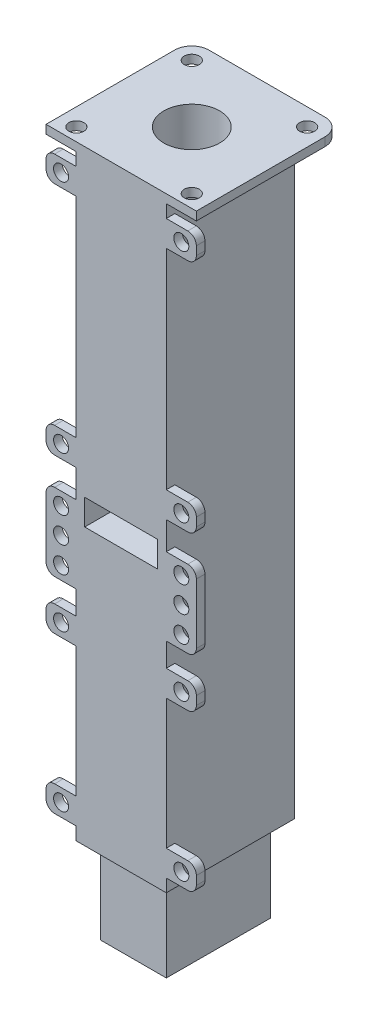
from build123d import *

# Parameters (mm, degrees)
ESQUISSE1_W                   = 35
ESQUISSE1_H                   = 35
BOSS_EXTRU_1_DEPTH            = 2
ESQUISSE2_R                   = 1.75
ESQUISSE2_W                   = 35
ESQUISSE2_H                   = 1.064971157
ENL_V_MAT_EXTRU_1_DEPTH       = 2
BOSS_EXTRU_2_DEPTH            = 280
ESQUISSE5_W                   = 7
ESQUISSE5_H                   = 6
ESQUISSE5_R                   = 1.75
BOSS_EXTRU_3_DEPTH            = 2
ESQUISSE6_R                   = 1.75
BOSS_EXTRU_4_DEPTH            = 2
ESQUISSE10_W                  = 35
ESQUISSE10_H                  = 33.935028843
ESQUISSE10_R                  = 1.75
BOSS_EXTRU_5_DEPTH            = 2
ESQUISSE15_R                  = 6.5
ESQUISSE15_R_2                = 1.75
ENL_V_MAT_EXTRU_2_DEPTH       = 373
CONG_1_R                      = 2
CONG_2_R                      = 4
EXTRU_MINCE1_START            = -2
EXTRU_MINCE1_OUTLINE_W        = 35
EXTRU_MINCE1_OUTLINE_H        = 10
EXTRU_MINCE1_DEPTH            = 2
BOSS_EXTRU_7_DEPTH            = 62.5
BOSS_EXTRU_8_DEPTH            = 160
ENL_V_MAT_EXTRU_4_DEPTH       = 15
BOSS_EXTRU_31_DEPTH           = 69.5
BOSS_EXTRU_31_DEPTH_BACK      = 90.5
ESQUISSE29_W                  = 0.210775501
ESQUISSE29_H                  = 2
BOSS_EXTRU_32_DEPTH           = 160
ENL_V_MAT_EXTRU_7_DEPTH       = 10
ENL_V_MAT_EXTRU_7_DEPTH_BACK  = 5
ESQUISSE34_W                  = 144
ESQUISSE34_H                  = 64.710678118
ENL_V_MAT_EXTRU_8_DEPTH       = 2
ESQUISSE35_R                  = 1.5
BOSS_EXTRU_35_DEPTH           = 2
BOSS_EXTRU_36_START           = -2
ESQUISSE36_R                  = 1.5
BOSS_EXTRU_36_DEPTH           = 2
BOSS_EXTRU_37_DEPTH           = 21
BOSS_EXTRU_38_DEPTH           = 28
ESQUISSE42_W                  = 17
ESQUISSE42_H                  = 6
ENL_V_MAT_EXTRU_9_DEPTH       = 124
ESQUISSE43_R                  = 1.1
ENL_V_MAT_EXTRU_11_DEPTH      = 50
ESQUISSE45_R                  = 1.5
ENL_V_MAT_EXTRU_12_DEPTH      = 50
ESQUISSE47_R                  = 1.75
BOSS_EXTRU_40_DEPTH           = 2
ENL_V_MAT_EXTRU_13_DEPTH      = 2
ESQUISSE49_R                  = 1.75
BOSS_EXTRU_41_DEPTH           = 2
ESQUISSE50_W                  = 12.927363302
ESQUISSE50_H                  = 18
ENL_V_MAT_EXTRU_14_DEPTH      = 2
ESQUISSE51_R                  = 1.75
BOSS_EXTRU_42_DEPTH           = 2
BOSS_EXTRU_43_DEPTH           = 2
BOSS_EXTRU_43_DEPTH_BACK      = 2
ESQUISSE53_R                  = 1.75
ENL_V_START                   = -2
ESQUISSE54_R                  = 1.75
ENL_V_MAT_EXTRU_15_DEPTH      = 2
BOSS_EXTRU_44_DEPTH           = 2
BOSS_EXTRU_44_DEPTH_BACK      = 2
ESQUISSE55_R                  = 1.75
ENL_V_MAT_EXTRU_16_DEPTH      = 131
ESQUISSE57_R                  = 6.500000627
BOSS_EXTRU_45_DEPTH           = 20
ENL_V_MAT_EXTRU_17_DEPTH      = 171
ENL_V_MAT_EXTRU_17_DEPTH_BACK = 20


# Read off the part's stored shape, not the designer's step: Extru.-Mince1
with BuildPart() as part:
    # Esquisse1 → Boss.-Extru.1 (new body)
    with BuildSketch(Plane(origin=(0, 0, 0), x_dir=(1, 0, 0), z_dir=(0, 1, 0))):
        with Locations((17.5, -17.5)):
            Rectangle(ESQUISSE1_W, ESQUISSE1_H)
    extrude(amount=BOSS_EXTRU_1_DEPTH)

    # Esquisse2 → Enlèv. mat.-Extru.1 (cut)
    with BuildSketch(Plane(origin=(0, 2, 0), x_dir=(1, 0, 0), z_dir=(0, 1, 0))):
        with Locations(Location((30.935029054, -4.064971369, 0), (0, 0, 270))):
            Circle(ESQUISSE2_R)
        with Locations(Location((30.935028843, -30.935028843, 0), (0, 0, 270))):
            Circle(ESQUISSE2_R)
        with Locations(Location((4.064971369, -4.064970946, 0), (0, 0, 270))):
            Circle(ESQUISSE2_R)
        with Locations(Location((4.064971157, -30.935028843, 0), (0, 0, 270))):
            Circle(ESQUISSE2_R)
        with Locations((17.5, -34.467514421)):
            Rectangle(ESQUISSE2_W, ESQUISSE2_H)
    extrude(amount=-ENL_V_MAT_EXTRU_1_DEPTH, mode=Mode.SUBTRACT)

    # Esquisse4 → Boss.-Extru.2 (add)
    with BuildSketch(Plane(origin=(0, 2, 0), x_dir=(1, 0, 0), z_dir=(0, 1, 0))):
        Polygon((17.5, -33.935028843), (7, -33.935028843), (7, -4.064970946), (28, -4.064970946), (28, -33.935028843), align=None)
    extrude(amount=BOSS_EXTRU_2_DEPTH)

    # Esquisse5 → Boss.-Extru.3 (add)
    # profile 1 of 4: a face of its own
    with BuildSketch(Plane.XY.offset(33.935028843)):
        with Locations((31.5, 254)):
            Rectangle(ESQUISSE5_W, ESQUISSE5_H)
        with Locations((31.5, 254)):
            Circle(ESQUISSE5_R, mode=Mode.SUBTRACT)
    # profile 2 of 4: a face of its own
    with BuildSketch(Plane.XY.offset(33.935028843)):
        with Locations((3.5, 254)):
            Rectangle(ESQUISSE5_W, ESQUISSE5_H)
        with Locations((3.5, 254)):
            Circle(ESQUISSE5_R, mode=Mode.SUBTRACT)
    # profile 3 of 4: a face of its own
    with BuildSketch(Plane.XY.offset(33.935028843)):
        with Locations((31.5, 28)):
            Rectangle(ESQUISSE5_W, ESQUISSE5_H)
        with Locations((31.5, 28)):
            Circle(ESQUISSE5_R, mode=Mode.SUBTRACT)
    # profile 4 of 4: a face of its own
    with BuildSketch(Plane.XY.offset(33.935028843)):
        with Locations((3.5, 28)):
            Rectangle(ESQUISSE5_W, ESQUISSE5_H)
        with Locations((3.5, 28)):
            Circle(ESQUISSE5_R, mode=Mode.SUBTRACT)
    extrude(amount=-BOSS_EXTRU_3_DEPTH)

    # Esquisse6 → Boss.-Extru.4 (add)
    # profile 1 of 2: a face of its own
    with BuildSketch(Plane.XY.offset(33.935028843)):
        Polygon((7, 144), (0, 144), (0, 141), (0, 138), (7, 138), (7, 141), align=None)
        with Locations((3.5, 141)):
            Circle(ESQUISSE6_R, mode=Mode.SUBTRACT)
    # profile 2 of 2: a face of its own
    with BuildSketch(Plane.XY.offset(33.935028843)):
        Polygon((35, 144), (28, 144), (28, 141), (28, 138), (35, 138), (35, 141), align=None)
        with Locations((31.5, 141)):
            Circle(ESQUISSE6_R, mode=Mode.SUBTRACT)
    extrude(amount=-BOSS_EXTRU_4_DEPTH)

    # Esquisse10 → Boss.-Extru.5 (add)
    with BuildSketch(Plane(origin=(0, 282, 0), x_dir=(1, 0, 0), z_dir=(0, 1, 0))):
        with Locations((17.5, -16.967514422)):
            Rectangle(ESQUISSE10_W, ESQUISSE10_H)
        with Locations(Location((30.935028843, -30.935028843, 0), (0, 0, 270))):
            Circle(ESQUISSE10_R, mode=Mode.SUBTRACT)
        with Locations(Location((30.935028631, -4.064970946, 0), (0, 0, 270.000013863))):
            Circle(ESQUISSE10_R, mode=Mode.SUBTRACT)
        with Locations(Location((4.064970946, -4.064971369, 0), (0, 0, 270.000013863))):
            Circle(ESQUISSE10_R, mode=Mode.SUBTRACT)
        with Locations(Location((4.064971157, -30.935028843, 0), (0, 0, 270))):
            Circle(ESQUISSE10_R, mode=Mode.SUBTRACT)
    extrude(amount=-BOSS_EXTRU_5_DEPTH)

    # Esquisse15 → Enlèv. mat.-Extru.2 (cut)
    with BuildSketch(Plane(origin=(0, 282, 0), x_dir=(1, 0, 0), z_dir=(0, 1, 0))):
        with Locations(Location((17.5, -17.5, 0), (0, 0, 270))):
            Circle(ESQUISSE15_R)
        with Locations(Location((30.935029054, -4.064971369, 0), (0, 0, 270))):
            Circle(ESQUISSE15_R_2)
    extrude(amount=-ENL_V_MAT_EXTRU_2_DEPTH, mode=Mode.SUBTRACT)

    # Congé1
    cong_1_edges = [part.edges().sort_by_distance(p)[0] for p in [
        (0, 31, 32.935028843),
        (0, 25, 32.935028843),
        (0, 144, 32.935028843),
        (0, 138, 32.935028843),
        (35, 144, 32.935028843),
        (35, 138, 32.935028843),
        (35, 257, 32.935028843),
        (35, 251, 32.935028843),
        (0, 251, 32.935028843),
        (0, 257, 32.935028843),
        (35, 31, 32.935028843),
        (35, 25, 32.935028843),
    ]]
    fillet(cong_1_edges, radius=CONG_1_R)

    # Congé2
    cong_2_edges = [part.edges().sort_by_distance(p)[0] for p in [
        (35, 281, 0),
        (0, 281, 0),
        (0, 1, 0),
        (35, 1, 0),
    ]]
    fillet(cong_2_edges, radius=CONG_2_R)

    # Extru.-Mince1 outline → Extru.-Mince1 (add)
    with BuildSketch(Plane(origin=(0, 282, 0), x_dir=(1, 0, 0), z_dir=(0, 1, 0)).offset(EXTRU_MINCE1_START)):
        with Locations((17.5, -38.935028843)):
            Rectangle(EXTRU_MINCE1_OUTLINE_W, EXTRU_MINCE1_OUTLINE_H)
    extrude(amount=EXTRU_MINCE1_DEPTH)

    # Esquisse20 → Boss.-Extru.7 (add)
    with BuildSketch(Plane.ZY):
        Polygon((43.935028843, 282), (114.645706961, 211.289321881), (110.645706961, 211.289321881), (41.935028843, 280), (34.145804344, 280), (34.145804344, 282), align=None)
    extrude(amount=BOSS_EXTRU_7_DEPTH)

    # Esquisse21 → Boss.-Extru.8 (add)
    with BuildSketch(Plane.ZY.offset(62.5)):
        Polygon((34.145804344, 280), (41.935028843, 280), (110.645706961, 211.289321881), (114.645706961, 211.289321881), (43.935028843, 282), (34.145804344, 282), align=None)
    extrude(amount=-BOSS_EXTRU_8_DEPTH)

    # Esquisse22 → Enlèv. mat.-Extru.4 (cut)
    with BuildSketch(Plane(origin=(0, 162.967514421, 162.967514421), x_dir=(1, 0, 0), z_dir=(0, 0.7071067811865462, 0.7071067811865488))):
        Polygon((-42.064466094, 147.626821562), (-45.6, 147.626821562), (-45.6, 89.047889374), (-42.064466094, 89.047889374), (-42.064466094, 85.512355468), (77.064466094, 85.512355468), (77.064466094, 89.047889374), (80.6, 89.047889374), (80.6, 147.626821562), (77.064466094, 147.626821562), (77.064466094, 151.162355468), (-42.064466094, 151.162355468), align=None)
    extrude(amount=-ENL_V_MAT_EXTRU_4_DEPTH, mode=Mode.SUBTRACT)

    # Esquisse29 → Boss.-Extru.31 (add, two sides: drawn at the far end of the back side and taken through both)
    with BuildSketch(Plane.ZY.offset(-7).offset(-BOSS_EXTRU_31_DEPTH_BACK)):
        with Locations((34.040416594, 281)):
            Rectangle(ESQUISSE29_W, ESQUISSE29_H)
    extrude(amount=BOSS_EXTRU_31_DEPTH + BOSS_EXTRU_31_DEPTH_BACK)

    # Esquisse32 → Boss.-Extru.32 (add)
    with BuildSketch(Plane.ZY.offset(62.5)):
        Polygon((110.645706961, 211.289321881), (33.935028843, 211.289321881), (33.935028843, 280), (35.935028843, 280), (35.935028843, 213.289321881), (108.645706961, 213.289321881), align=None)
    extrude(amount=-BOSS_EXTRU_32_DEPTH)

    # Esquisse33 → Enlèv. mat.-Extru.7 (cut, two sides: drawn at the far end of the back side and taken through both)
    with BuildSketch(Plane(origin=(0, 0, 33.935028843), x_dir=(-1, 0, 0), z_dir=(0, 0, -1)).offset(-ENL_V_MAT_EXTRU_7_DEPTH_BACK)):
        Polygon((-28, 274.000000001), (-89.5, 274.000000001), (-89.5, 219.289321881), (-81.5, 219.289321881), (-28, 219.289321881), align=None)
        with BuildLine():
            Line((54.5, 274.000000001), (-7, 274.000000001))
            Line((-7, 274.000000001), (-7, 257))
            Line((-7, 257), (-2, 257))
            ThreePointArc((-2, 257), (-0.585786438, 256.414213562), (0, 255))
            Line((0, 255), (0, 253))
            ThreePointArc((0, 253), (-0.585786438, 251.585786438), (-2, 251))
            Line((-2, 251), (-7, 251))
            Line((-7, 251), (-7, 219.289321881))
            Line((-7, 219.289321881), (1, 219.289321881))
            Line((1, 219.289321881), (54.5, 219.289321881))
            Line((54.5, 219.289321881), (54.5, 274.000000001))
        make_face()
        with BuildLine():
            Line((-2, 257), (-7, 257))
            Line((-7, 257), (-7, 251))
            Line((-7, 251), (-2, 251))
            ThreePointArc((-2, 251), (-0.585786438, 251.585786438), (0, 253))
            Line((0, 253), (0, 255))
            ThreePointArc((0, 255), (-0.585786438, 256.414213562), (-2, 257))
        make_face()
    extrude(amount=ENL_V_MAT_EXTRU_7_DEPTH + ENL_V_MAT_EXTRU_7_DEPTH_BACK, mode=Mode.SUBTRACT)

    # Esquisse34 → Enlèv. mat.-Extru.8 (cut)
    with BuildSketch(Plane.XZ.offset(-211.289321881)):
        with Locations((17.5, 74.290367902)):
            Rectangle(ESQUISSE34_W, ESQUISSE34_H)
    extrude(amount=-ENL_V_MAT_EXTRU_8_DEPTH, mode=Mode.SUBTRACT)

    # Esquisse35 → Boss.-Extru.35 (add)
    with BuildSketch(Plane(origin=(97.5, 0, 0), x_dir=(0, 0, -1), z_dir=(1, 0, 0))):
        Polygon((-35.935028843, 280), (-35.935028843, 274.000000001), (-35.935028843, 213.289321881), (-108.645706961, 213.289321881), (-102.645706961, 219.289321881), (-41.935028842, 219.289321881), (-41.935028842, 274.000000001), (-47.935028841, 274.000000001), (-41.935028843, 280), align=None)
        with Locations((-38.935028842, 216.289321881)):
            Circle(ESQUISSE35_R, mode=Mode.SUBTRACT)
        with Locations((-38.935028842, 277.000000001)):
            Circle(ESQUISSE35_R, mode=Mode.SUBTRACT)
        with Locations((-99.645706961, 216.289321881)):
            Circle(ESQUISSE35_R, mode=Mode.SUBTRACT)
    extrude(amount=-BOSS_EXTRU_35_DEPTH)

    # Esquisse36 → Boss.-Extru.36 (add)
    with BuildSketch(Plane.ZY.offset(62.5).offset(BOSS_EXTRU_36_START)):
        Polygon((35.935028843, 213.289321881), (108.645706961, 213.289321881), (102.645706961, 219.289321881), (41.935028842, 219.289321881), (41.935028842, 274.000000001), (47.935028841, 274.000000001), (41.935028843, 280), (35.935028843, 280), (35.935028843, 274.000000001), align=None)
        with Locations(Location((99.645706961, 216.289321881, 0), (0, 0, 180))):
            Circle(ESQUISSE36_R, mode=Mode.SUBTRACT)
        with Locations(Location((38.935028842, 277.000000001, 0), (0, 0, 180))):
            Circle(ESQUISSE36_R, mode=Mode.SUBTRACT)
        with Locations(Location((38.935028842, 216.289321881, 0), (0, 0, 180))):
            Circle(ESQUISSE36_R, mode=Mode.SUBTRACT)
    extrude(amount=BOSS_EXTRU_36_DEPTH)

    # Esquisse39 → Boss.-Extru.37 (add)
    with BuildSketch(Plane(origin=(28, 0, 0), x_dir=(0, 0, -1), z_dir=(1, 0, 0))):
        Polygon((-33.935028843, 211.289321881), (-33.935028843, 191.289321881), (-118.935028843, 201.289321881), (-118.935028843, 211.289321881), align=None)
    extrude(amount=-BOSS_EXTRU_37_DEPTH)

    # Esquisse40 → Boss.-Extru.38 (add)
    with BuildSketch(Plane.XY.offset(118.935028843)):
        Polygon((7, 201.289321881), (2, 201.289321881), (2, 203.289321881), (33, 203.289321881), (33, 201.289321881), (28, 201.289321881), align=None)
    extrude(amount=BOSS_EXTRU_38_DEPTH)

    # Esquisse42 → Enlèv. mat.-Extru.9 (cut)
    with BuildSketch(Plane.XY.offset(118.935028843)):
        with Locations((17.5, 208.289321881)):
            Rectangle(ESQUISSE42_W, ESQUISSE42_H)
    extrude(amount=-ENL_V_MAT_EXTRU_9_DEPTH, mode=Mode.SUBTRACT)

    # Esquisse43 → Enlèv. mat.-Extru.11 (cut)
    with BuildSketch(Plane(origin=(0, 203.289321881, 0), x_dir=(1, 0, 0), z_dir=(0, 1, 0))):
        with Locations(Location((5, -144.935028843, 0), (0, 0, 270))):
            Circle(ESQUISSE43_R)
        with Locations(Location((30, -144.935028843, 0), (0, 0, 270))):
            Circle(ESQUISSE43_R)
        with Locations(Location((5, -130.435028843, 0), (0, 0, 270))):
            Circle(ESQUISSE43_R)
        with Locations(Location((30, -130.435028843, 0), (0, 0, 270))):
            Circle(ESQUISSE43_R)
        with BuildLine():
            Line((5, -123.319506434), (5, -128.435028843))
            ThreePointArc((5, -128.435028843), (7, -130.435028843), (5, -132.435028843))
            Line((5, -132.435028843), (5, -142.935028843))
            ThreePointArc((5, -142.935028843), (6.414213562, -143.52081528), (7, -144.935028843))
            Line((7, -144.935028843), (28, -144.935028843))
            ThreePointArc((28, -144.935028843), (28.585786438, -143.52081528), (30, -142.935028843))
            Line((30, -142.935028843), (30, -132.435028843))
            ThreePointArc((30, -132.435028843), (28, -130.435028843), (30, -128.435028843))
            Line((30, -128.435028843), (30, -123.319506434))
            Line((30, -123.319506434), (5, -123.319506434))
        make_face()
    extrude(amount=-ENL_V_MAT_EXTRU_11_DEPTH, mode=Mode.SUBTRACT)

    # Esquisse45 → Enlèv. mat.-Extru.12 (cut)
    with BuildSketch(Plane(origin=(0, 162.967514421, 162.967514421), x_dir=(1, 0, 0), z_dir=(0, 0.7071067811865462, 0.7071067811865488))):
        with Locations(Location((80.6, 151.162355468, 0), (0, 0, 270))):
            Circle(ESQUISSE45_R)
        with Locations(Location((80.6, 85.512355468, 0), (0, 0, 270))):
            Circle(ESQUISSE45_R)
        with Locations(Location((-45.6, 85.512355468, 0), (0, 0, 270))):
            Circle(ESQUISSE45_R)
        with Locations(Location((-45.6, 151.162355468, 0), (0, 0, 270))):
            Circle(ESQUISSE45_R)
    extrude(amount=-ENL_V_MAT_EXTRU_12_DEPTH, mode=Mode.SUBTRACT)

    # Esquisse47 → Boss.-Extru.40 (add)
    # profile 1 of 4: a face of its own
    with BuildSketch(Plane.XY.offset(33.935028843)):
        with BuildLine():
            Line((2, 144), (7, 144))
            Line((7, 144), (7, 150))
            Line((7, 150), (2, 150))
            ThreePointArc((2, 150), (0.585786438, 149.414213562), (0, 148))
            Line((0, 148), (0, 146))
            ThreePointArc((0, 146), (0.585786438, 144.585786438), (2, 144))
        make_face()
        with Locations((3.5, 147)):
            Circle(ESQUISSE47_R, mode=Mode.SUBTRACT)
    # profile 2 of 4: a face of its own
    with BuildSketch(Plane.XY.offset(33.935028843)):
        with BuildLine():
            Line((28, 150), (28, 144))
            Line((28, 144), (33, 144))
            ThreePointArc((33, 144), (34.414213562, 144.585786438), (35, 146))
            Line((35, 146), (35, 148))
            ThreePointArc((35, 148), (34.414213562, 149.414213562), (33, 150))
            Line((33, 150), (28, 150))
        make_face()
        with Locations((31.5, 147)):
            Circle(ESQUISSE47_R, mode=Mode.SUBTRACT)
    # profile 3 of 4: a face of its own
    with BuildSketch(Plane.XY.offset(33.935028843)):
        with BuildLine():
            Line((35, 134), (35, 136))
            ThreePointArc((35, 136), (34.414213562, 137.414213562), (33, 138))
            Line((33, 138), (28, 138))
            Line((28, 138), (28, 132))
            Line((28, 132), (33, 132))
            ThreePointArc((33, 132), (34.414213562, 132.585786438), (35, 134))
        make_face()
        with Locations((31.5, 135)):
            Circle(ESQUISSE47_R, mode=Mode.SUBTRACT)
    # profile 4 of 4: a face of its own
    with BuildSketch(Plane.XY.offset(33.935028843)):
        with BuildLine():
            Line((7, 138), (2, 138))
            ThreePointArc((2, 138), (0.585786438, 137.414213562), (0, 136))
            Line((0, 136), (0, 134))
            ThreePointArc((0, 134), (0.585786438, 132.585786438), (2, 132))
            Line((2, 132), (7, 132))
            Line((7, 132), (7, 138))
        make_face()
        with Locations((3.5, 135)):
            Circle(ESQUISSE47_R, mode=Mode.SUBTRACT)
    extrude(amount=-BOSS_EXTRU_40_DEPTH)

    # Esquisse48 → Enlèv. mat.-Extru.13 (cut)
    with BuildSketch(Plane.XY.offset(33.935028843)):
        Polygon((-4.556540033, 144), (-4.556540033, 138), (2, 138), (7, 138), (7, 144), (2, 144), align=None)
        Polygon((33.295178048, 144), (39.851718081, 144), (39.851718081, 138), (33.295178048, 138), (28.295178048, 138), (28.295178048, 144), align=None)
    extrude(amount=-ENL_V_MAT_EXTRU_13_DEPTH, mode=Mode.SUBTRACT)

    # Esquisse49 → Boss.-Extru.41 (add)
    # profile 1 of 2: a face of its own
    with BuildSketch(Plane.XY.offset(33.935028843)):
        with BuildLine():
            Line((2, 180.289321881), (7, 180.289321881))
            Line((7, 180.289321881), (7, 186.289321881))
            Line((7, 186.289321881), (2, 186.289321881))
            ThreePointArc((2, 186.289321881), (0.585786438, 185.703535444), (0, 184.289321881))
            Line((0, 184.289321881), (0, 182.289321881))
            ThreePointArc((0, 182.289321881), (0.585786438, 180.875108319), (2, 180.289321881))
        make_face()
        with Locations((3.5, 183.289321881)):
            Circle(ESQUISSE49_R, mode=Mode.SUBTRACT)
    # profile 2 of 2: a face of its own
    with BuildSketch(Plane.XY.offset(33.935028843)):
        with BuildLine():
            Line((35, 182.289321881), (35, 184.289321881))
            ThreePointArc((35, 184.289321881), (34.414213562, 185.703535444), (33, 186.289321881))
            Line((33, 186.289321881), (28, 186.289321881))
            Line((28, 186.289321881), (28, 180.289321881))
            Line((28, 180.289321881), (33, 180.289321881))
            ThreePointArc((33, 180.289321881), (34.414213562, 180.875108319), (35, 182.289321881))
        make_face()
        with Locations((31.5, 183.289321881)):
            Circle(ESQUISSE49_R, mode=Mode.SUBTRACT)
    extrude(amount=-BOSS_EXTRU_41_DEPTH)

    # Esquisse50 → Enlèv. mat.-Extru.14 (cut)
    with BuildSketch(Plane.XY.offset(33.935028843)):
        with Locations((34.463681651, 141)):
            Rectangle(ESQUISSE50_W, ESQUISSE50_H)
    extrude(amount=-ENL_V_MAT_EXTRU_14_DEPTH, mode=Mode.SUBTRACT)

    # Esquisse51 → Boss.-Extru.42 (add)
    # profile 1 of 3: a face of its own
    with BuildSketch(Plane.XY.offset(33.935028843)):
        with BuildLine():
            Line((7, 150), (7, 144))
            Line((7, 144), (2, 144))
            ThreePointArc((2, 144), (0.585786438, 144.585786438), (0, 146))
            Line((0, 146), (0, 148))
            ThreePointArc((0, 148), (0.585786438, 149.414213562), (2, 150))
            Line((2, 150), (7, 150))
        make_face()
        with Locations((3.5, 147)):
            Circle(ESQUISSE51_R, mode=Mode.SUBTRACT)
    # profile 2 of 3: a face of its own
    with BuildSketch(Plane.XY.offset(33.935028843)):
        with BuildLine():
            Line((33, 138.018442997), (28, 138.018442997))
            Line((28, 138.018442997), (28, 132.018442997))
            Line((28, 132.018442997), (33, 132.018442997))
            ThreePointArc((33, 132.018442997), (34.414213562, 132.604229434), (35, 134.018442997))
            Line((35, 134.018442997), (35, 136.018442997))
            ThreePointArc((35, 136.018442997), (34.414213562, 137.432656559), (33, 138.018442997))
        make_face()
        with Locations((31.5, 135.018442997)):
            Circle(ESQUISSE51_R, mode=Mode.SUBTRACT)
    # profile 3 of 3: a face of its own
    with BuildSketch(Plane.XY.offset(33.935028843)):
        with BuildLine():
            Line((33, 150), (28, 150))
            Line((28, 150), (28, 144))
            Line((28, 144), (33, 144))
            ThreePointArc((33, 144), (34.414213562, 144.585786438), (35, 146))
            Line((35, 146), (35, 148))
            ThreePointArc((35, 148), (34.414213562, 149.414213562), (33, 150))
        make_face()
        with Locations((31.5, 147)):
            Circle(ESQUISSE51_R, mode=Mode.SUBTRACT)
    extrude(amount=-BOSS_EXTRU_42_DEPTH)

    # Esquisse53 → Boss.-Extru.43 (add, two sides: drawn at the far end of the back side and taken through both)
    # profile 1 of 4: a face of its own
    with BuildSketch(Plane(origin=(0, 0, 33.935028843), x_dir=(-1, 0, 0), z_dir=(0, 0, -1)).offset(-BOSS_EXTRU_43_DEPTH_BACK)):
        with BuildLine():
            Line((0, 275.000000001), (0, 273.000000001))
            ThreePointArc((0, 273.000000001), (-0.585786438, 271.585786439), (-2, 271.000000001))
            Line((-2, 271.000000001), (-7, 271.000000001))
            Line((-7, 271.000000001), (-7, 277.000000001))
            Line((-7, 277.000000001), (-2, 277.000000001))
            ThreePointArc((-2, 277.000000001), (-0.585786438, 276.414213564), (0, 275.000000001))
        make_face()
        with Locations(Location((-3.5, 274.000000001, 0), (0, 0, 180))):
            Circle(ESQUISSE53_R, mode=Mode.SUBTRACT)
    # profile 2 of 4: a face of its own
    with BuildSketch(Plane(origin=(0, 0, 33.935028843), x_dir=(-1, 0, 0), z_dir=(0, 0, -1)).offset(-BOSS_EXTRU_43_DEPTH_BACK)):
        with BuildLine():
            Line((-28, 222.289321881), (-28, 216.289321881))
            Line((-28, 216.289321881), (-33, 216.289321881))
            ThreePointArc((-33, 216.289321881), (-34.414213562, 216.875108319), (-35, 218.289321881))
            Line((-35, 218.289321881), (-35, 220.289321881))
            ThreePointArc((-35, 220.289321881), (-34.414213562, 221.703535444), (-33, 222.289321881))
            Line((-33, 222.289321881), (-28, 222.289321881))
        make_face()
        with Locations((-31.5, 219.289321881)):
            Circle(ESQUISSE53_R, mode=Mode.SUBTRACT)
    # profile 3 of 4: a face of its own
    with BuildSketch(Plane(origin=(0, 0, 33.935028843), x_dir=(-1, 0, 0), z_dir=(0, 0, -1)).offset(-BOSS_EXTRU_43_DEPTH_BACK)):
        with BuildLine():
            Line((-28, 277.000000001), (-28, 271.000000001))
            Line((-28, 271.000000001), (-33, 271.000000001))
            ThreePointArc((-33, 271.000000001), (-34.414213562, 271.585786439), (-35, 273.000000001))
            Line((-35, 273.000000001), (-35, 275.000000001))
            ThreePointArc((-35, 275.000000001), (-34.414213562, 276.414213564), (-33, 277.000000001))
            Line((-33, 277.000000001), (-28, 277.000000001))
        make_face()
        with Locations((-31.5, 274.000000001)):
            Circle(ESQUISSE53_R, mode=Mode.SUBTRACT)
    # profile 4 of 4: a face of its own
    with BuildSketch(Plane(origin=(0, 0, 33.935028843), x_dir=(-1, 0, 0), z_dir=(0, 0, -1)).offset(-BOSS_EXTRU_43_DEPTH_BACK)):
        with BuildLine():
            Line((0, 220.289321881), (0, 218.289321881))
            ThreePointArc((0, 218.289321881), (-0.585786438, 216.875108319), (-2, 216.289321881))
            Line((-2, 216.289321881), (-7, 216.289321881))
            Line((-7, 216.289321881), (-7, 222.289321881))
            Line((-7, 222.289321881), (-2, 222.289321881))
            ThreePointArc((-2, 222.289321881), (-0.585786438, 221.703535444), (0, 220.289321881))
        make_face()
        with Locations(Location((-3.5, 219.289321881, 0), (0, 0, 180))):
            Circle(ESQUISSE53_R, mode=Mode.SUBTRACT)
    extrude(amount=BOSS_EXTRU_43_DEPTH + BOSS_EXTRU_43_DEPTH_BACK)

    # Esquisse54 → Enlèv. mat.-Extru.15 (cut)
    with BuildSketch(Plane(origin=(0, 0, 33.935028843), x_dir=(-1, 0, 0), z_dir=(0, 0, -1)).offset(ENL_V_START)):
        with Locations((-31.5, 274.000000001)):
            Circle(ESQUISSE54_R)
        with Locations(Location((-3.5, 274.000000001, 0), (0, 0, 180))):
            Circle(ESQUISSE54_R)
        with Locations((-31.5, 219.289321881)):
            Circle(ESQUISSE54_R)
        with Locations(Location((-3.5, 219.289321881, 0), (0, 0, 180))):
            Circle(ESQUISSE54_R)
    extrude(amount=ENL_V_MAT_EXTRU_15_DEPTH, mode=Mode.SUBTRACT)

    # Esquisse55 → Boss.-Extru.44 (add, two sides: drawn at the far end of the back side and taken through both)
    # profile 1 of 2: a face of its own
    with BuildSketch(Plane(origin=(0, 0, 33.935028843), x_dir=(-1, 0, 0), z_dir=(0, 0, -1)).offset(-BOSS_EXTRU_44_DEPTH_BACK)):
        with BuildLine():
            Line((0, 207.789321881), (0, 205.789321881))
            Line((0, 205.789321881), (0, 201.789321881))
            Line((0, 201.789321881), (0, 199.789321881))
            Line((0, 199.789321881), (0, 195.789321881))
            Line((0, 195.789321881), (0, 193.789321881))
            ThreePointArc((0, 193.789321881), (-0.585786438, 192.375108319), (-2, 191.789321881))
            Line((-2, 191.789321881), (-7, 191.789321881))
            Line((-7, 191.789321881), (-7, 197.789321881))
            Line((-7, 197.789321881), (-7, 203.789321881))
            Line((-7, 203.789321881), (-7, 209.789321881))
            Line((-7, 209.789321881), (-2, 209.789321881))
            ThreePointArc((-2, 209.789321881), (-0.585786438, 209.203535444), (0, 207.789321881))
        make_face()
        with Locations((-3.5, 206.789321881)):
            Circle(ESQUISSE55_R, mode=Mode.SUBTRACT)
        with Locations((-3.5, 194.789321881)):
            Circle(ESQUISSE55_R, mode=Mode.SUBTRACT)
        with Locations((-3.5, 200.789321881)):
            Circle(ESQUISSE55_R, mode=Mode.SUBTRACT)
    # profile 2 of 2: a face of its own
    with BuildSketch(Plane(origin=(0, 0, 33.935028843), x_dir=(-1, 0, 0), z_dir=(0, 0, -1)).offset(-BOSS_EXTRU_44_DEPTH_BACK)):
        with BuildLine():
            Line((-35, 195.789321881), (-35, 193.789321881))
            ThreePointArc((-35, 193.789321881), (-34.414213562, 192.375108319), (-33, 191.789321881))
            Line((-33, 191.789321881), (-28, 191.789321881))
            Line((-28, 191.789321881), (-28, 197.789321881))
            Line((-28, 197.789321881), (-28, 203.789321881))
            Line((-28, 203.789321881), (-28, 209.789321881))
            Line((-28, 209.789321881), (-33, 209.789321881))
            ThreePointArc((-33, 209.789321881), (-34.414213562, 209.203535444), (-35, 207.789321881))
            Line((-35, 207.789321881), (-35, 205.789321881))
            Line((-35, 205.789321881), (-35, 201.789321881))
            Line((-35, 201.789321881), (-35, 199.789321881))
            Line((-35, 199.789321881), (-35, 195.789321881))
        make_face()
        with Locations((-31.5, 194.789321881)):
            Circle(ESQUISSE55_R, mode=Mode.SUBTRACT)
        with Locations((-31.5, 206.789321881)):
            Circle(ESQUISSE55_R, mode=Mode.SUBTRACT)
        with Locations((-31.5, 200.789321881)):
            Circle(ESQUISSE55_R, mode=Mode.SUBTRACT)
    extrude(amount=BOSS_EXTRU_44_DEPTH + BOSS_EXTRU_44_DEPTH_BACK)

    # Esquisse56 → Enlèv. mat.-Extru.16 (cut)
    with BuildSketch(Plane.XY.offset(33.935028843)):
        Polygon((7, 141), (28, 141.009221498), (216.808097721, 141.009221498), (216.808097721, -73.231368857), (-139.28120446, -73.231368857), (-139.28120446, 141), align=None)
    extrude(amount=-ENL_V_MAT_EXTRU_16_DEPTH, mode=Mode.SUBTRACT)

    # Esquisse57 → Boss.-Extru.45 (add)
    with BuildSketch(Plane(origin=(-0.061914413, 140.996898979, 0), x_dir=(0.9999999035872799, 0.00043911892589698507, 0), z_dir=(0.000439118925896985, -0.9999999035872797, 0))):
        Polygon((9.891659575, 31.106601718), (25.234803301, 31.106601718), (25.294523475, 6.89339807), (9.951379749, 6.89339807), align=None)
        with Locations(Location((17.561916106, 17.5, 0), (0, 0, 89.87558623))):
            Circle(ESQUISSE57_R, mode=Mode.SUBTRACT)
    extrude(amount=BOSS_EXTRU_45_DEPTH)

    # Esquisse59 → Enlèv. mat.-Extru.17 (cut, two sides: drawn at the far end of the back side and taken through both)
    with BuildSketch(Plane.XZ.offset(-280).offset(-ENL_V_MAT_EXTRU_17_DEPTH_BACK)):
        Polygon((-89.60318851, 33.935028843), (0, 33.935028843), (7, 33.935028843), (28, 33.935028843), (35, 33.935028843), (131.449730425, 33.935028843), (131.449730425, 169.08090331), (-89.60318851, 169.08090331), align=None)
    extrude(amount=ENL_V_MAT_EXTRU_17_DEPTH + ENL_V_MAT_EXTRU_17_DEPTH_BACK, mode=Mode.SUBTRACT)


solid = part.part
